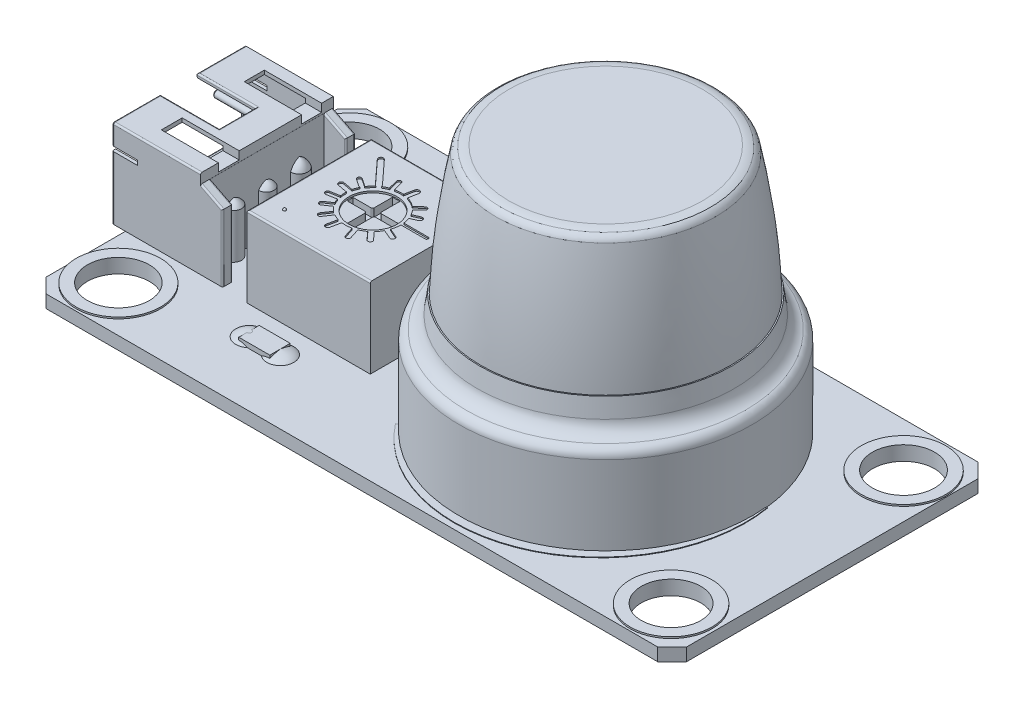
from build123d import *

# Parameters (mm, degrees)
CROQUIS1_W               = 40
CROQUIS1_H               = 20
SALIENTE_EXTRUIR1_DEPTH  = 0.8
CHAFL_N1_SIZE            = 0.9
CROQUIS2_R               = 2.563501178
CROQUIS2_R_2             = 1.863501178
SALIENTE_EXTRUIR2_DEPTH  = 0.1
CROQUIS3_R               = 2.63430269
CROQUIS3_R_2             = 1.93430269
SALIENTE_EXTRUIR3_DEPTH  = 0.1
CROQUIS4_R               = 1.863501178
CORTAR_EXTRUIR1_DEPTH    = 23.419693593
CROQUIS5_R               = 1.93430269
CORTAR_EXTRUIR2_DEPTH    = 23.419693593
CROQUIS6_R               = 2.639737899
CROQUIS6_R_2             = 1.939737899
SALIENTE_EXTRUIR4_DEPTH  = 0.1
CROQUIS7_R               = 1.939737899
CORTAR_EXTRUIR3_DEPTH    = 23.419693593
CROQUIS8_R               = 2.554627201
CROQUIS8_R_2             = 1.854627201
SALIENTE_EXTRUIR5_DEPTH  = 0.1
CROQUIS9_R               = 1.854627201
CORTAR_EXTRUIR4_DEPTH    = 23.419693593
CROQUIS10_R              = 9.147847318
SALIENTE_EXTRUIR6_DEPTH  = 5.5
CROQUIS12_W              = 7.711264444
CROQUIS12_H              = 7.77447153
SALIENTE_EXTRUIR7_DEPTH  = 5
CROQUIS13_W              = 0.487294196
CROQUIS13_H              = 4.644382448
CROQUIS13_W_2            = 0.604282285
CROQUIS13_W_3            = 0.631677662
CORTAR_EXTRUIR6_DEPTH    = 0.5
CROQUIS14_W              = 0.162808197
CROQUIS14_H              = 4.62921408
CORTAR_EXTRUIR7_DEPTH    = 0.5
CROQUIS15_R              = 1.5
CORTAR_EXTRUIR8_DEPTH    = 0.2
CORTAR_EXTRUIR9_DEPTH    = 0.5
CROQUIS17_R              = 1.5
CORTAR_EXTRUIR10_DEPTH   = 0.09
REDONDEO3_R              = 0.1
REDONDEO4_R              = 0.1
CROQUIS19_W              = 1.93781559
CROQUIS19_H              = 1.276122462
SALIENTE_EXTRUIR8_DEPTH  = 0.3
CROQUIS22_W              = 7.711264444
CROQUIS22_H              = 8.280128216
SALIENTE_EXTRUIR9_DEPTH  = 5.5
CROQUIS23_W              = 1.369126528
CROQUIS23_H              = 7.079966235
CORTAR_EXTRUIR11_DEPTH   = 5.5
CORTAR_EXTRUIR12_DEPTH   = 9.5
CROQUIS25_W              = 0.820912642
CROQUIS25_H              = 5.5
CORTAR_EXTRUIR13_DEPTH   = 9.5
CROQUIS30_W              = 7.092837749
CROQUIS30_H              = 0.465863506
CORTAR_EXTRUIR14_DEPTH   = 4.5
CORTAR_EXTRUIR15_DEPTH   = 4.5
CROQUIS32_W              = 1.579361297
CROQUIS32_H              = 0.290202164
CORTAR_EXTRUIR16_DEPTH   = 11.5
CROQUIS33_W              = 4.936040286
CROQUIS33_H              = 2.282665694
CORTAR_EXTRUIR17_DEPTH   = 3.5
CROQUIS34_W              = 3.917666029
CROQUIS34_H              = 1.250479239
CORTAR_EXTRUIR18_DEPTH   = 0.5
CROQUIS35_W              = 5.136503206
CROQUIS35_H              = 1.3
CORTAR_EXTRUIR19_DEPTH   = 0.5
REDONDEO5_R              = 0.1
REDONDEO6_R              = 0.1
CROQUIS36_R              = 0.212902741
SALIENTE_EXTRUIR10_DEPTH = 4.5
REDONDEO7_SIZE           = 0.1
SALIENTE_EXTRUIR11_DEPTH = 0.04
CROQUIS38_R              = 8.147847318
SALIENTE_EXTRUIR12_DEPTH = 2
SALIENTE_EXTRUIR12_TAPER = 8
REDONDEO8_R              = 1
REDONDEO9_R              = 0.6


with BuildPart() as part:
    # Croquis1 → Saliente-Extruir1 (new body)
    with BuildSketch(Plane(origin=(0, 0, 0), x_dir=(1, 0, 0), z_dir=(0, 1, 0))):
        Rectangle(CROQUIS1_W, CROQUIS1_H)
    extrude(amount=SALIENTE_EXTRUIR1_DEPTH)

    # Chaflán1
    chafl_n1_edges = [part.edges().sort_by_distance(p)[0] for p in [
        (-20, 0.4, -10),
        (20, 0.4, -10),
        (20, 0.4, 10),
        (-20, 0.4, 10),
    ]]
    chamfer(chafl_n1_edges, length=CHAFL_N1_SIZE)

    # Croquis2 → Saliente-Extruir2 (add)
    with BuildSketch(Plane(origin=(0, 0.8, 0), x_dir=(1, 0, 0), z_dir=(0, 1, 0))):
        with Locations(Location((-17.486502833, 7.354431697, 0), (0, 0, 168.664732408))):
            Circle(CROQUIS2_R)
        with Locations(Location((-17.486502833, 7.354431697, 0), (0, 0, 270))):
            Circle(CROQUIS2_R_2, mode=Mode.SUBTRACT)
    extrude(amount=SALIENTE_EXTRUIR2_DEPTH)

    # Croquis3 → Saliente-Extruir3 (add)
    with BuildSketch(Plane(origin=(0, 0.8, 0), x_dir=(1, 0, 0), z_dir=(0, 1, 0))):
        with Locations(Location((-17.343743463, -7.237211302, 0), (0, 0, 270))):
            Circle(CROQUIS3_R)
        with Locations(Location((-17.343743463, -7.237211302, 0), (0, 0, 270))):
            Circle(CROQUIS3_R_2, mode=Mode.SUBTRACT)
    extrude(amount=SALIENTE_EXTRUIR3_DEPTH)

    # Croquis4 → Cortar-Extruir1 (cut, through all)
    with BuildSketch(Plane(origin=(0, 0.8, 0), x_dir=(1, 0, 0), z_dir=(0, 1, 0))):
        with Locations(Location((-17.486502833, 7.354431697, 0), (0, 0, 270))):
            Circle(CROQUIS4_R)
    extrude(amount=-CORTAR_EXTRUIR1_DEPTH, mode=Mode.SUBTRACT)

    # Croquis5 → Cortar-Extruir2 (cut, through all)
    with BuildSketch(Plane(origin=(0, 0.8, 0), x_dir=(1, 0, 0), z_dir=(0, 1, 0))):
        with Locations(Location((-17.343743463, -7.237211302, 0), (0, 0, 270))):
            Circle(CROQUIS5_R)
    extrude(amount=-CORTAR_EXTRUIR2_DEPTH, mode=Mode.SUBTRACT)

    # Croquis6 → Saliente-Extruir4 (add)
    with BuildSketch(Plane(origin=(0, 0.8, 0), x_dir=(1, 0, 0), z_dir=(0, 1, 0))):
        with Locations(Location((17.305953642, 7.142905367, 0), (0, 0, 270))):
            Circle(CROQUIS6_R)
        with Locations(Location((17.305953642, 7.142905367, 0), (0, 0, 270))):
            Circle(CROQUIS6_R_2, mode=Mode.SUBTRACT)
    extrude(amount=SALIENTE_EXTRUIR4_DEPTH)

    # Croquis7 → Cortar-Extruir3 (cut, through all)
    with BuildSketch(Plane(origin=(0, 0.8, 0), x_dir=(1, 0, 0), z_dir=(0, 1, 0))):
        with Locations(Location((17.305953642, 7.142905367, 0), (0, 0, 270))):
            Circle(CROQUIS7_R)
    extrude(amount=-CORTAR_EXTRUIR3_DEPTH, mode=Mode.SUBTRACT)

    # Croquis8 → Saliente-Extruir5 (add)
    with BuildSketch(Plane(origin=(0, 0.8, 0), x_dir=(1, 0, 0), z_dir=(0, 1, 0))):
        with Locations(Location((17.258545284, -7.324743745, 0), (0, 0, 270))):
            Circle(CROQUIS8_R)
        with Locations(Location((17.258545284, -7.324743745, 0), (0, 0, 270))):
            Circle(CROQUIS8_R_2, mode=Mode.SUBTRACT)
    extrude(amount=SALIENTE_EXTRUIR5_DEPTH)

    # Croquis9 → Cortar-Extruir4 (cut, through all)
    with BuildSketch(Plane(origin=(0, 0.8, 0), x_dir=(1, 0, 0), z_dir=(0, 1, 0))):
        with Locations(Location((17.258545284, -7.324743745, 0), (0, 0, 270))):
            Circle(CROQUIS9_R)
    extrude(amount=-CORTAR_EXTRUIR4_DEPTH, mode=Mode.SUBTRACT)

    # Croquis10 → Saliente-Extruir6 (add)
    with BuildSketch(Plane(origin=(0, 0.8, 0), x_dir=(1, 0, 0), z_dir=(0, 1, 0))):
        with Locations(Location((5.853256957, 0, 0), (0, 0, 270))):
            Circle(CROQUIS10_R)
    extrude(amount=SALIENTE_EXTRUIR6_DEPTH)

    # Croquis12 → Saliente-Extruir7 (add)
    with BuildSketch(Plane(origin=(0, 0.8, 0), x_dir=(1, 0, 0), z_dir=(0, 1, 0))):
        with Locations((-8.486038846, -0.334001576)):
            Rectangle(CROQUIS12_W, CROQUIS12_H)
    extrude(amount=SALIENTE_EXTRUIR7_DEPTH)

    # Croquis13 → Cortar-Extruir6 (cut)
    with BuildSketch(Plane.ZY.offset(12.341671068)):
        with Locations((-3.004542589, 3.122191224)):
            Rectangle(CROQUIS13_W, CROQUIS13_H)
        with Locations((0.031860434, 3.122191224)):
            Rectangle(CROQUIS13_W_2, CROQUIS13_H)
        with Locations((3.528809231, 3.122191224)):
            Rectangle(CROQUIS13_W_3, CROQUIS13_H)
    extrude(amount=-CORTAR_EXTRUIR6_DEPTH, mode=Mode.SUBTRACT)

    # Croquis14 → Cortar-Extruir7 (cut)
    with BuildSketch(Plane.ZY.offset(12.341671068)):
        with Locations((0.602339698, 3.11460704)):
            Rectangle(CROQUIS14_W, CROQUIS14_H)
    extrude(amount=-CORTAR_EXTRUIR7_DEPTH, mode=Mode.SUBTRACT)

    # Croquis15 → Cortar-Extruir8 (cut)
    with BuildSketch(Plane(origin=(0, 5.8, 0), x_dir=(1, 0, 0), z_dir=(0, 1, 0))):
        with Locations(Location((-8.486038846, -0.193365188, 0), (0, 0, 270))):
            Circle(CROQUIS15_R)
    extrude(amount=-CORTAR_EXTRUIR8_DEPTH, mode=Mode.SUBTRACT)

    # Croquis16 → Cortar-Extruir9 (cut)
    with BuildSketch(Plane(origin=(0, 5.6, 0), x_dir=(1, 0, 0), z_dir=(0, 1, 0))):
        Polygon((-8.613079471, -1.605053744), (-8.299530316, -1.605053744), (-8.247956714, -1.605053744), (-8.247956714, -0.372873894), (-7.061522222, -0.372873894), (-7.061522222, -0.312883922), (-7.061522222, -0.077891256), (-7.061522222, 0), (-8.247956714, 0), (-8.247956714, 1.242381616), (-8.299530316, 1.242381616), (-8.613079471, 1.242381616), (-8.703811896, 1.242381616), (-8.703811896, 0), (-9.914219858, 0), (-9.914219858, -0.077891256), (-9.914219858, -0.312883922), (-9.914219858, -0.372873894), (-8.703811896, -0.372873894), (-8.703811896, -1.605053744), align=None)
    extrude(amount=-CORTAR_EXTRUIR9_DEPTH, mode=Mode.SUBTRACT)

    # Croquis17 → Cortar-Extruir10 (cut)
    with BuildSketch(Plane(origin=(0, 5.8, 0), x_dir=(1, 0, 0), z_dir=(0, 1, 0))):
        with BuildLine():
            Line((-6.752367186, 0), (-5.255463579, 0))
            ThreePointArc((-5.255463579, 0), (-5.133083695, -0.092725715), (-5.24904313, -0.193365188))
            Line((-5.24904313, -0.193365188), (-6.741617016, -0.193365188))
            ThreePointArc((-6.741617016, -0.193365188), (-6.764169107, -0.472957969), (-6.831242268, -0.745321533))
            ThreePointArc((-6.831242268, -0.745321533), (-6.828446206, -0.74641833), (-6.825673504, -0.747572906))
            Line((-6.825673504, -0.747572906), (-6.275797031, -0.983269507))
            ThreePointArc((-6.275797031, -0.983269507), (-6.199782388, -1.17333597), (-6.389848851, -1.249350614))
            Line((-6.389848851, -1.249350614), (-6.939725324, -1.013654012))
            ThreePointArc((-6.939725324, -1.013654012), (-6.942473474, -1.012442155), (-6.945195887, -1.011173538))
            ThreePointArc((-6.945195887, -1.011173538), (-7.067088863, -1.208051576), (-7.213984234, -1.387050484))
            ThreePointArc((-7.213984234, -1.387050484), (-7.211925813, -1.389192151), (-7.209912021, -1.391375836))
            Line((-7.209912021, -1.391375836), (-6.77587672, -1.871883467))
            ThreePointArc((-6.77587672, -1.871883467), (-6.786208084, -2.075197491), (-6.989522108, -2.064866127))
            Line((-6.989522108, -2.064866127), (-7.42355741, -1.584358497))
            ThreePointArc((-7.42355741, -1.584358497), (-7.425525713, -1.582133723), (-7.427447691, -1.579868808))
            ThreePointArc((-7.427447691, -1.579868808), (-7.616764452, -1.705770408), (-7.820847714, -1.805980542))
            ThreePointArc((-7.820847714, -1.805980542), (-7.819903287, -1.808642589), (-7.819012615, -1.811323099))
            Line((-7.819012615, -1.811323099), (-7.619331434, -2.433108693))
            ThreePointArc((-7.619331434, -2.433108693), (-7.710060354, -2.609678259), (-7.886629919, -2.518949339))
            Line((-7.886629919, -2.518949339), (-8.0863111, -1.897163746))
            ThreePointArc((-8.0863111, -1.897163746), (-8.087147656, -1.894465856), (-8.087929758, -1.89175168))
            ThreePointArc((-8.087929758, -1.89175168), (-8.395496384, -1.935435676), (-8.705934461, -1.923871888))
            ThreePointArc((-8.705934461, -1.923871888), (-8.706461582, -1.926801321), (-8.707049099, -1.92971924))
            Line((-8.707049099, -1.92971924), (-8.838377518, -2.548849209))
            ThreePointArc((-8.838377518, -2.548849209), (-9.009236256, -2.659908207), (-9.120295254, -2.48904947))
            Line((-9.120295254, -2.48904947), (-8.988966835, -1.869919501))
            ThreePointArc((-8.988966835, -1.869919501), (-8.988319173, -1.867014339), (-8.987611643, -1.864123175))
            ThreePointArc((-8.987611643, -1.864123175), (-9.171113496, -1.797634569), (-9.346039293, -1.711063034))
            ThreePointArc((-9.346039293, -1.711063034), (-9.347594427, -1.713508113), (-9.349199068, -1.71592099))
            Line((-9.349199068, -1.71592099), (-9.694365309, -2.223644587))
            ThreePointArc((-9.694365309, -2.223644587), (-9.891878046, -2.261289716), (-9.929523175, -2.063776979))
            Line((-9.929523175, -2.063776979), (-9.584356935, -1.556053382))
            ThreePointArc((-9.584356935, -1.556053382), (-9.582703452, -1.553673709), (-9.581001815, -1.551328228))
            ThreePointArc((-9.581001815, -1.551328228), (-9.720218731, -1.42616993), (-9.845221747, -1.286813569))
            ThreePointArc((-9.845221747, -1.286813569), (-9.847555366, -1.288503156), (-9.849922838, -1.290144971))
            Line((-9.849922838, -1.290144971), (-10.314199097, -1.605177444))
            ThreePointArc((-10.314199097, -1.605177444), (-10.511109712, -1.567467504), (-10.473399772, -1.370556889))
            Line((-10.473399772, -1.370556889), (-10.009123513, -1.055524416))
            ThreePointArc((-10.009123513, -1.055524416), (-10.006723166, -1.05393105), (-10.004290935, -1.052386792))
            ThreePointArc((-10.004290935, -1.052386792), (-10.075810654, -0.911441172), (-10.134279577, -0.764600704))
            ThreePointArc((-10.134279577, -0.764600704), (-10.164472454, -0.782617667), (-10.198112844, -0.792842387))
            Line((-10.198112844, -0.792842387), (-10.742016536, -0.888223224))
            ThreePointArc((-10.742016536, -0.888223224), (-10.909977963, -0.770381269), (-10.792136008, -0.602419842))
            Line((-10.792136008, -0.602419842), (-10.248232316, -0.507039004))
            ThreePointArc((-10.248232316, -0.507039004), (-10.225214961, -0.504872738), (-10.202145745, -0.506390161))
            ThreePointArc((-10.202145745, -0.506390161), (-10.226791534, -0.30644746), (-10.228220958, -0.104996583))
            ThreePointArc((-10.228220958, -0.104996583), (-10.252855928, -0.106210992), (-10.277376419, -0.103546027))
            Line((-10.277376419, -0.103546027), (-10.854762333, 0.005710848))
            ThreePointArc((-10.854762333, 0.005710848), (-10.979635034, 0.188871755), (-10.796474127, 0.313744456))
            Line((-10.796474127, 0.313744456), (-10.219088213, 0.204487582))
            ThreePointArc((-10.219088213, 0.204487582), (-10.202657027, 0.200448935), (-10.186756882, 0.194662753))
            ThreePointArc((-10.186756882, 0.194662753), (-10.1316672, 0.385353086), (-10.055271645, 0.568550781))
            ThreePointArc((-10.055271645, 0.568550781), (-10.104393581, 0.569344427), (-10.149670062, 0.588413639))
            Line((-10.149670062, 0.588413639), (-10.608812421, 0.895741177))
            ThreePointArc((-10.608812421, 0.895741177), (-10.644323507, 1.07502656), (-10.465038125, 1.110537646))
            Line((-10.465038125, 1.110537646), (-10.005895765, 0.803210108))
            ThreePointArc((-10.005895765, 0.803210108), (-9.977201908, 0.776963609), (-9.95761468, 0.743369612))
            ThreePointArc((-9.95761468, 0.743369612), (-9.80782251, 0.945008856), (-9.630623453, 1.12304417))
            ThreePointArc((-9.630623453, 1.12304417), (-9.667998659, 1.140299707), (-9.699573292, 1.166713758))
            Line((-9.699573292, 1.166713758), (-11.03603756, 2.62422304))
            ThreePointArc((-11.03603756, 2.62422304), (-11.026468931, 2.845087125), (-10.805604846, 2.835518496))
            Line((-10.805604846, 2.835518496), (-9.469140578, 1.378009213))
            ThreePointArc((-9.469140578, 1.378009213), (-9.43912712, 1.330193588), (-9.42805552, 1.274835107))
            ThreePointArc((-9.42805552, 1.274835107), (-9.258521447, 1.370693043), (-9.079358518, 1.447055272))
            ThreePointArc((-9.079358518, 1.447055272), (-9.101983975, 1.475755151), (-9.115785464, 1.509594674))
            Line((-9.115785464, 1.509594674), (-9.247113883, 2.030240829))
            ThreePointArc((-9.247113883, 2.030240829), (-9.152284139, 2.189048343), (-8.993476625, 2.094218599))
            Line((-8.993476625, 2.094218599), (-8.862148206, 1.573572445))
            ThreePointArc((-8.862148206, 1.573572445), (-8.858176172, 1.541820118), (-8.862033321, 1.510053632))
            ThreePointArc((-8.862033321, 1.510053632), (-8.589274007, 1.547999226), (-8.313941877, 1.54254672))
            ThreePointArc((-8.313941877, 1.54254672), (-8.31375673, 1.562616585), (-8.311145262, 1.582516685))
            Line((-8.311145262, 1.582516685), (-8.206057678, 2.125678643))
            ThreePointArc((-8.206057678, 2.125678643), (-8.011991378, 2.256824857), (-7.880845164, 2.062758556))
            Line((-7.880845164, 2.062758556), (-7.985932747, 1.519596598))
            ThreePointArc((-7.985932747, 1.519596598), (-7.990932186, 1.500158508), (-7.998246176, 1.481467887))
            ThreePointArc((-7.998246176, 1.481467887), (-7.673622944, 1.350327761), (-7.381725329, 1.157004826))
            ThreePointArc((-7.381725329, 1.157004826), (-7.368927382, 1.177678119), (-7.352496056, 1.195599726))
            Line((-7.352496056, 1.195599726), (-6.969668216, 1.54158356))
            ThreePointArc((-6.969668216, 1.54158356), (-6.786469257, 1.532322205), (-6.795730612, 1.349123246))
            Line((-6.795730612, 1.349123246), (-7.178558451, 1.003139412))
            ThreePointArc((-7.178558451, 1.003139412), (-7.189489304, 0.994288429), (-7.201314251, 0.986673047))
            ThreePointArc((-7.201314251, 0.986673047), (-7.079578598, 0.838563632), (-6.974831338, 0.677989726))
            ThreePointArc((-6.974831338, 0.677989726), (-6.960254176, 0.68777065), (-6.944649726, 0.695811874))
            Line((-6.944649726, 0.695811874), (-6.54455216, 0.873644287))
            ThreePointArc((-6.54455216, 0.873644287), (-6.343222482, 0.796215233), (-6.420651536, 0.594885556))
            Line((-6.420651536, 0.594885556), (-6.820749102, 0.417053143))
            ThreePointArc((-6.820749102, 0.417053143), (-6.83438993, 0.411758245), (-6.848475361, 0.407794818))
            ThreePointArc((-6.848475361, 0.407794818), (-6.788134033, 0.206793239), (-6.752367186, 0))
        make_face()
        with Locations(Location((-8.486038846, -0.193365188, 0), (0, 0, 270))):
            Circle(CROQUIS17_R, mode=Mode.SUBTRACT)
    extrude(amount=-CORTAR_EXTRUIR10_DEPTH, mode=Mode.SUBTRACT)

    # Redondeo3
    redondeo3_edges = [part.edges().sort_by_distance(p)[0] for p in [
        (-12.341671068, 5.8, 0.334001576),
        (-8.486038846, 5.8, 4.221237341),
        (-8.486038846, 5.8, -3.553234189),
    ]]
    fillet(redondeo3_edges, radius=REDONDEO3_R)

    # Redondeo4
    redondeo4_edges = [part.edges().sort_by_distance(p)[0] for p in [
        (-8.703811896, 5.35, 0.372873894),
        (-8.703811896, 5.35, 0),
        (-8.247956714, 5.35, 0),
        (-8.247956714, 5.35, 0.372873894),
    ]]
    fillet(redondeo4_edges, radius=REDONDEO4_R)

    # Croquis18 → Revolución1 (revolve)
    with BuildSketch(Plane(origin=(0, 5.8, 0), x_dir=(1, 0, 0), z_dir=(0, 1, 0))):
        with BuildLine():
            Line((-11.287068668, -3.00454063), (-11.102235753, -3.00454063))
            ThreePointArc((-11.102235753, -3.00454063), (-11.194652211, -2.912124172), (-11.287068668, -3.00454063))
        make_face()
    revolve(axis=Axis((-11.287068668, 5.8, 3.00454063), (1, 0, 0)))

    # Croquis19 → Saliente-Extruir8 (add)
    with BuildSketch(Plane(origin=(0, 0.8, 0), x_dir=(1, 0, 0), z_dir=(0, 1, 0))):
        with Locations((-9.465419961, -5.991420445)):
            Rectangle(CROQUIS19_W, CROQUIS19_H)
    extrude(amount=SALIENTE_EXTRUIR8_DEPTH)

    # Croquis20 → Revolución2 (revolve)
    with BuildSketch(Plane.XY.offset(5.97)):
        with BuildLine():
            Line((-8.496512166, 1.1), (-8.496512166, 0.8))
            Line((-8.496512166, 0.8), (-7.650096537, 0.8))
            add(Edge.make_bspline(
                [(-8.496512166, 1.1), (-8.205596023, 1.04118429), (-7.887227562, 0.996192946), (-7.650096537, 0.8)],
                knots=[0, 0, 0, 0, 1, 1, 1, 1], degree=3))
        make_face()
    revolve(axis=Axis((-8.496512166, 1.1, 5.97), (0, -1, 0)))

    # Croquis21 → Revolución3 (revolve)
    with BuildSketch(Plane.XY.offset(5.97)):
        with BuildLine():
            Line((-10.434327756, 1.1), (-10.434327756, 0.8))
            Line((-10.434327756, 0.8), (-11.220020356, 0.8))
            Line((-11.220020356, 0.8), (-11.280329691, 0.8))
            add(Edge.make_bspline(
                [(-10.434327756, 1.1), (-10.918604602, 1.127081835), (-11.280329691, 0.8)],
                knots=[0, 0, 0, 1, 1, 1], degree=2))
        make_face()
    revolve(axis=Axis((-10.434327756, 1.1, 5.97), (0, -1, 0)))

    # Croquis22 → Saliente-Extruir9 (add)
    with BuildSketch(Plane(origin=(0, 0.8, 0), x_dir=(1, 0, 0), z_dir=(0, 1, 0))):
        with Locations((-17.786193062, 0)):
            Rectangle(CROQUIS22_W, CROQUIS22_H)
    extrude(amount=SALIENTE_EXTRUIR9_DEPTH)

    # Croquis23 → Cortar-Extruir11 (cut)
    with BuildSketch(Plane(origin=(0, 6.3, 0), x_dir=(1, 0, 0), z_dir=(0, 1, 0))):
        with Locations((-14.615124104, 0.01826936)):
            Rectangle(CROQUIS23_W, CROQUIS23_H)
    extrude(amount=-CORTAR_EXTRUIR11_DEPTH, mode=Mode.SUBTRACT)

    # Croquis24 → Cortar-Extruir12 (cut)
    with BuildSketch(Plane.XY.offset(4.140064108)):
        Polygon((-15.302213168, 6.3), (-15.302213168, 5.684909915), (-13.93056084, 4.988519783), (-13.93056084, 6.3), align=None)
    extrude(amount=-CORTAR_EXTRUIR12_DEPTH, mode=Mode.SUBTRACT)

    # Croquis25 → Cortar-Extruir13 (cut)
    with BuildSketch(Plane.XY.offset(4.140064108)):
        with Locations((-21.231368963, 3.55)):
            Rectangle(CROQUIS25_W, CROQUIS25_H)
    extrude(amount=-CORTAR_EXTRUIR13_DEPTH, mode=Mode.SUBTRACT)

    # Croquis27 → Revolución4 (revolve)
    with BuildSketch(Plane.XY.offset(2.090064108)):
        with BuildLine():
            Line((-15.302213168, 3.950046635), (-15.302213168, 0.8))
            Line((-15.302213168, 0.8), (-14.801160181, 0.8))
            Line((-14.801160181, 0.8), (-14.801160181, 3.6))
            add(Edge.make_bspline(
                [(-14.801160181, 3.6), (-15.001578067, 3.849006989), (-15.302213168, 3.950046635)],
                knots=[0, 0, 0, 1, 1, 1], degree=2))
        make_face()
    revolve(axis=Axis((-15.302213168, 3.950046635, 2.090064108), (0, -1, 0)))

    # Croquis28 → Revolución5 (revolve)
    with BuildSketch(Plane.XY.offset(0.040064108)):
        with BuildLine():
            Line((-15.302213168, 3.893159397), (-15.302213168, 0.8))
            Line((-15.302213168, 0.8), (-14.824987034, 0.8))
            Line((-14.824987034, 0.8), (-14.824987034, 3.55))
            add(Edge.make_bspline(
                [(-14.824987034, 3.55), (-14.993222111, 3.826137643), (-15.302213168, 3.893159397)],
                knots=[0, 0, 0, 1, 1, 1], degree=2))
        make_face()
    revolve(axis=Axis((-15.302213168, 3.893159397, 0.040064108), (0, -1, 0)))

    # Croquis29 → Revolución6 (revolve)
    with BuildSketch(Plane.XY.offset(-2.009935892)):
        with BuildLine():
            Line((-15.302213168, 4.114264325), (-15.302213168, 0.8))
            Line((-15.302213168, 0.8), (-14.764073995, 0.8))
            Line((-14.764073995, 0.8), (-14.764073995, 3.55))
            add(Edge.make_bspline(
                [(-14.764073995, 3.55), (-14.921131227, 3.948170483), (-15.302213168, 4.114264325)],
                knots=[0, 0, 0, 1, 1, 1], degree=2))
        make_face()
    revolve(axis=Axis((-15.302213168, 4.114264325, -2.009935892), (0, -1, 0)))

    # Croquis30 → Cortar-Extruir14 (cut)
    with BuildSketch(Plane.ZY.offset(20.820912642)):
        with Locations((-0.024738815, 1.032931753)):
            Rectangle(CROQUIS30_W, CROQUIS30_H)
    extrude(amount=-CORTAR_EXTRUIR14_DEPTH, mode=Mode.SUBTRACT)

    # Croquis31 → Cortar-Extruir15 (cut)
    with BuildSketch(Plane.ZY.offset(20.820912642)):
        Polygon((-3.934432231, 6.063051888), (-3.934432231, 1.496924787), (3.880322846, 1.496924787), (3.93138207, 1.496924787), (3.93138207, 6.063051888), (3.880322846, 6.063051888), align=None)
    extrude(amount=-CORTAR_EXTRUIR15_DEPTH, mode=Mode.SUBTRACT)

    # Croquis32 → Cortar-Extruir16 (cut)
    with BuildSketch(Plane.XY.offset(4.140064108)):
        with Locations((-20.031231994, 4.883685763)):
            Rectangle(CROQUIS32_W, CROQUIS32_H)
    extrude(amount=-CORTAR_EXTRUIR16_DEPTH, mode=Mode.SUBTRACT)

    # Croquis33 → Cortar-Extruir17 (cut)
    with BuildSketch(Plane(origin=(0, 6.3, 0), x_dir=(1, 0, 0), z_dir=(0, 1, 0))):
        with Locations((-19.605192055, 0)):
            Rectangle(CROQUIS33_W, CROQUIS33_H)
    extrude(amount=-CORTAR_EXTRUIR17_DEPTH, mode=Mode.SUBTRACT)

    # Croquis34 → Cortar-Extruir18 (cut)
    with BuildSketch(Plane(origin=(0, 6.3, 0), x_dir=(1, 0, 0), z_dir=(0, 1, 0))):
        with Locations((-16.920726996, 2.78816712)):
            Rectangle(CROQUIS34_W, CROQUIS34_H)
    extrude(amount=-CORTAR_EXTRUIR18_DEPTH, mode=Mode.SUBTRACT)

    # Croquis35 → Cortar-Extruir19 (cut)
    with BuildSketch(Plane(origin=(0, 6.3, 0), x_dir=(1, 0, 0), z_dir=(0, 1, 0))):
        with Locations((-16.29356015, -2.383269905)):
            Rectangle(CROQUIS35_W, CROQUIS35_H)
    extrude(amount=-CORTAR_EXTRUIR19_DEPTH, mode=Mode.SUBTRACT)

    # Redondeo5
    redondeo5_edges = [part.edges().sort_by_distance(p)[0] for p in [
        (-18.061562905, 6.3, 4.140064108),
        (-20.820912642, 6.3, -2.640698477),
        (-20.820912642, 2.769292341, -4.140064108),
        (-20.820912642, 2.769292341, 4.140064108),
        (-20.820912642, 1.265863506, -0.024738815),
        (-20.820912642, 6.063051888, 2.536357458),
        (-20.820912642, 1.496924787, -0.001525081),
        (-20.820912642, 5.664393423, 4.140064108),
        (-20.820912642, 5.664393423, -4.140064108),
        (-20.820912642, 6.063051888, -2.537882539),
        (-20.820912642, 6.3, 2.640698477),
        (-18.979042277, 6.3, -1.141332847),
        (-18.979042277, 6.3, 1.141332847),
        (-17.137171912, 6.3, 0),
    ]]
    fillet(redondeo5_edges, radius=REDONDEO5_R)

    # Redondeo6
    redondeo6_edges = [part.edges().sort_by_distance(p)[0] for p in [
        (-13.93056084, 2.894259891, -3.558252477),
        (-13.93056084, 2.894259891, 3.521713758),
        (-14.615124104, 5.336073673, -3.558252477),
        (-13.93056084, 2.894259891, -4.140064108),
        (-13.93056084, 2.894259891, 4.140064108),
        (-14.616387004, 5.336714849, -4.140064108),
        (-14.615124104, 5.336073673, 3.521713758),
        (-14.616387004, 5.336714849, 4.140064108),
    ]]
    fillet(redondeo6_edges, radius=REDONDEO6_R)

    # Croquis36 → Saliente-Extruir10 (add)
    with BuildSketch(Plane.ZY.offset(16.320912642)):
        with Locations((0, 4.636720715)):
            Circle(CROQUIS36_R)
        with Locations((-2.331707745, 4.636720715)):
            Circle(CROQUIS36_R)
        with Locations((2.431863744, 4.636720715)):
            Circle(CROQUIS36_R)
    extrude(amount=SALIENTE_EXTRUIR10_DEPTH)

    # Redondeo7
    # a fillet whose section is not a circle: 0.1 mm, written as the material it takes off along each edge
    with BuildSketch(Plane(origin=(-20.820912642, 4.636720715, 0), x_dir=(0, 0, 1), z_dir=(0, -1, 0))) as redondeo7_piece_1:
        with BuildLine():
            Bezier((0.212902741, -REDONDEO7_SIZE), (0.212902741, 0), (0.212902741 - REDONDEO7_SIZE, 0), weights=[1, 0.333333333, 1])
            Line((0.212902741 - REDONDEO7_SIZE, 0), (0.212902741, 0))
            Line((0.212902741, 0), (0.212902741, -REDONDEO7_SIZE))
        make_face()
    revolve(axis=Axis((-20.820912642, 4.636720715, 0), (-1, 0, 0)), mode=Mode.SUBTRACT)
    with BuildSketch(Plane(origin=(-20.820912642, 4.636720715, -2.331707745), x_dir=(0, 0, 1), z_dir=(0, -1, 0))) as redondeo7_piece_2:
        with BuildLine():
            Bezier((0.212902741, -REDONDEO7_SIZE), (0.212902741, 0), (0.212902741 - REDONDEO7_SIZE, 0), weights=[1, 0.333333333, 1])
            Line((0.212902741 - REDONDEO7_SIZE, 0), (0.212902741, 0))
            Line((0.212902741, 0), (0.212902741, -REDONDEO7_SIZE))
        make_face()
    revolve(axis=Axis((-20.820912642, 4.636720715, -2.331707745), (-1, 0, 0)), mode=Mode.SUBTRACT)
    with BuildSketch(Plane(origin=(-20.820912642, 4.636720715, 2.431863744), x_dir=(0, 0, 1), z_dir=(0, -1, 0))) as redondeo7_piece_3:
        with BuildLine():
            Bezier((0.212902741, -REDONDEO7_SIZE), (0.212902741, 0), (0.212902741 - REDONDEO7_SIZE, 0), weights=[1, 0.333333333, 1])
            Line((0.212902741 - REDONDEO7_SIZE, 0), (0.212902741, 0))
            Line((0.212902741, 0), (0.212902741, -REDONDEO7_SIZE))
        make_face()
    revolve(axis=Axis((-20.820912642, 4.636720715, 2.431863744), (-1, 0, 0)), mode=Mode.SUBTRACT)

    # Croquis37 → Saliente-Extruir11 (add)
    with BuildSketch(Plane(origin=(0, 0.8, 0), x_dir=(1, 0, 0), z_dir=(0, 1, 0))):
        with BuildLine():
            Line((-1.129811743, -6.146834888), (15.016942028, 0.947176231))
            ThreePointArc((15.016942028, 0.947176231), (9.703637668, -8.882059608), (-1.129811743, -6.146834888))
        make_face()
    extrude(amount=SALIENTE_EXTRUIR11_DEPTH)

    # Croquis38 → Saliente-Extruir12 (add)
    with BuildSketch(Plane(origin=(0, 6.3, 0), x_dir=(1, 0, 0), z_dir=(0, 1, 0))):
        with Locations((5.853256957, 0)):
            Circle(CROQUIS38_R)
    extrude(amount=SALIENTE_EXTRUIR12_DEPTH, taper=SALIENTE_EXTRUIR12_TAPER)

    # Redondeo8
    redondeo8_edges = [part.edges().sort_by_distance(p)[0] for p in [
        (-2.294590362, 6.3, 0),
    ]]
    fillet(redondeo8_edges, radius=REDONDEO8_R)

    # Redondeo9
    redondeo9_edges = [part.edges().sort_by_distance(p)[0] for p in [
        (5.853256957, 6.3, -9.147847318),
    ]]
    fillet(redondeo9_edges, radius=REDONDEO9_R)

    # Croquis40 → Revolución9 (revolve)
    with BuildSketch(Plane.XY, mode=Mode.PRIVATE) as revoluci_n9_sk:
        with BuildLine():
            Line((5.853256957, 8.3), (5.853256957, 16.320723909))
            Line((5.853256957, 16.320723909), (-0.187845017, 16.320723909))
            add(Edge.make_bspline(
                [(-0.685883303, 16.222446302), (-0.445677595, 16.312306165), (-0.187845017, 16.320723909)],
                knots=[0, 0, 0, 1, 1, 1], degree=2))
            add(Edge.make_bspline(
                [(-1.001065046, 15.865430217), (-0.917939855, 16.106746962), (-0.685883303, 16.222446302)],
                knots=[0, 0, 0, 1, 1, 1], degree=2))
            add(Edge.make_bspline(
                [(-1.941477693, 8.3), (-1.7782365, 12.123093182), (-1.001065046, 15.865430217)],
                knots=[0, 0, 0, 1, 1, 1], degree=2))
            Line((-1.941477693, 8.3), (5.853256957, 8.3))
        make_face()
    revolve(revoluci_n9_sk.sketch.rotate(Axis((5.853256957, 8.3, 0), (0, 1, 0)), 270), axis=Axis((5.853256957, 8.3, 0), (0, 1, 0)))


solid = part.part
